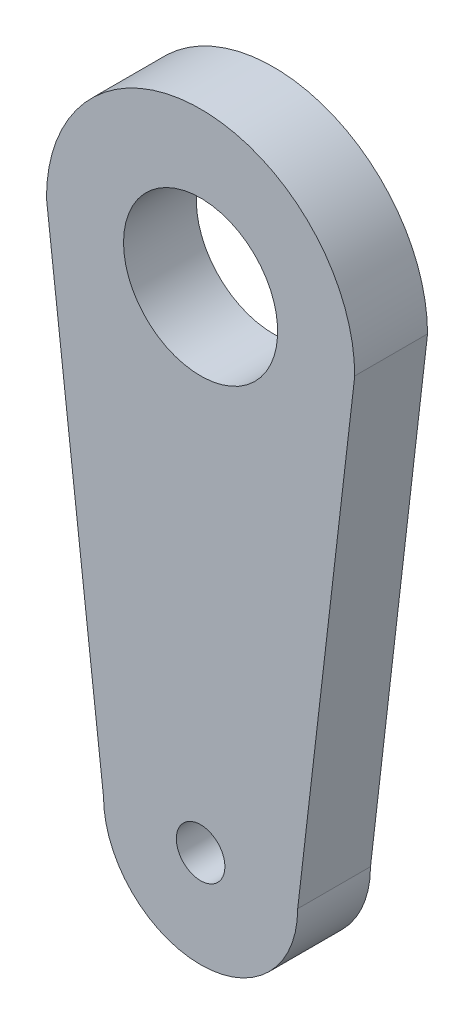
from build123d import *

# Parameters (mm, degrees)
SKETCH1_R           = 3.175
SKETCH1_R_2         = 1.000000032
BOSS_EXTRUDE1_DEPTH = 1.49987


with BuildPart() as part:
    # Sketch1 → Boss-Extrude1 (new, symmetric)
    with BuildSketch(Plane.XY):
        with BuildLine():
            ThreePointArc((6.35, 0), (0, 6.35), (-6.35, 0))
            Line((-6.35, 0), (-4.000000128, -20.183654293))
            ThreePointArc((-4.000000128, -20.183654293), (0, -24.183654421), (4.000000128, -20.183654293))
            Line((4.000000128, -20.183654293), (6.35, 0))
        make_face()
        Circle(SKETCH1_R, mode=Mode.SUBTRACT)
        with Locations((0, -20.183654293)):
            Circle(SKETCH1_R_2, mode=Mode.SUBTRACT)
    extrude(amount=BOSS_EXTRUDE1_DEPTH, both=True)


solid = part.part
